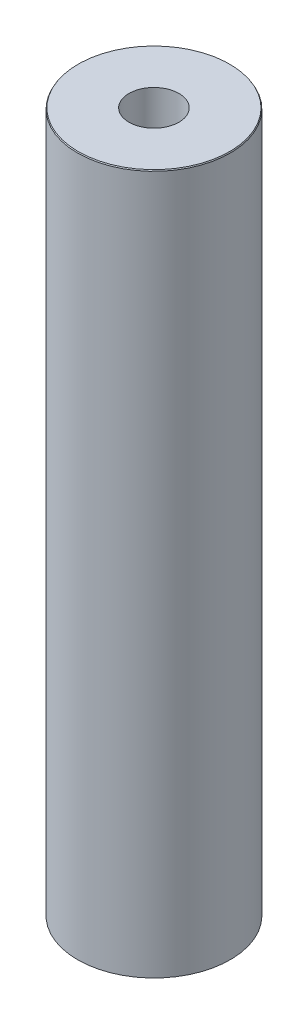
from build123d import *
from OCP.BRepFilletAPI import BRepFilletAPI_MakeChamfer

# Parameters (mm, degrees)
SKETCH1_R           = 20
BOSS_EXTRUDE1_DEPTH = 183.477704939
SKETCH2_R           = 6.543561398
CUT_EXTRUDE1_DEPTH  = 186.645005884
CHAMFER1_SIZE       = 0.268975032
CHAMFER1_SIZE2      = 0.155292807


with BuildPart() as part:
    # Sketch1 → Boss-Extrude1 (new body)
    with BuildSketch(Plane(origin=(0, 0, 0), x_dir=(1, 0, 0), z_dir=(0, 1, 0))):
        Circle(SKETCH1_R)
    extrude(amount=BOSS_EXTRUDE1_DEPTH)

    # Sketch2 → Cut-Extrude1 (cut, through all)
    with BuildSketch(Plane(origin=(0, 0, 0), x_dir=(1, 0, 0), z_dir=(0, 1, 0))):
        Circle(SKETCH2_R)
    extrude(amount=CUT_EXTRUDE1_DEPTH, mode=Mode.SUBTRACT)

    # Chamfer1: one chamfer whose edges measure the first distance from different faces: ONE call of the kernel's chamfer builder (chamfer() names one face for all edges)
    chamfer1_edges_1 = [part.edges().sort_by_distance(p)[0] for p in [
        (-20, 183.477704939, 0),
    ]]
    chamfer1_side_1 = [part.faces().sort_by_distance(p)[0] for p in [
        (-20, 91.738852469, 0),
    ]]
    chamfer1_edges_2 = [part.edges().sort_by_distance(p)[0] for p in [
        (-20, 0, 0),
    ]]
    chamfer1_side_2 = [part.faces().sort_by_distance(p)[0] for p in [
        (-19.434314575, 0, 0),
    ]]
    chamfer1 = BRepFilletAPI_MakeChamfer(part.part.solid().wrapped)
    for e in chamfer1_edges_1:
        chamfer1.Add(CHAMFER1_SIZE, CHAMFER1_SIZE2, e.wrapped, chamfer1_side_1[0].wrapped)  # the first distance lies on this face
    for e in chamfer1_edges_2:
        chamfer1.Add(CHAMFER1_SIZE, CHAMFER1_SIZE2, e.wrapped, chamfer1_side_2[0].wrapped)  # the first distance lies on this face
    add(Compound.cast(chamfer1.Shape()), mode=Mode.REPLACE)


solid = part.part
